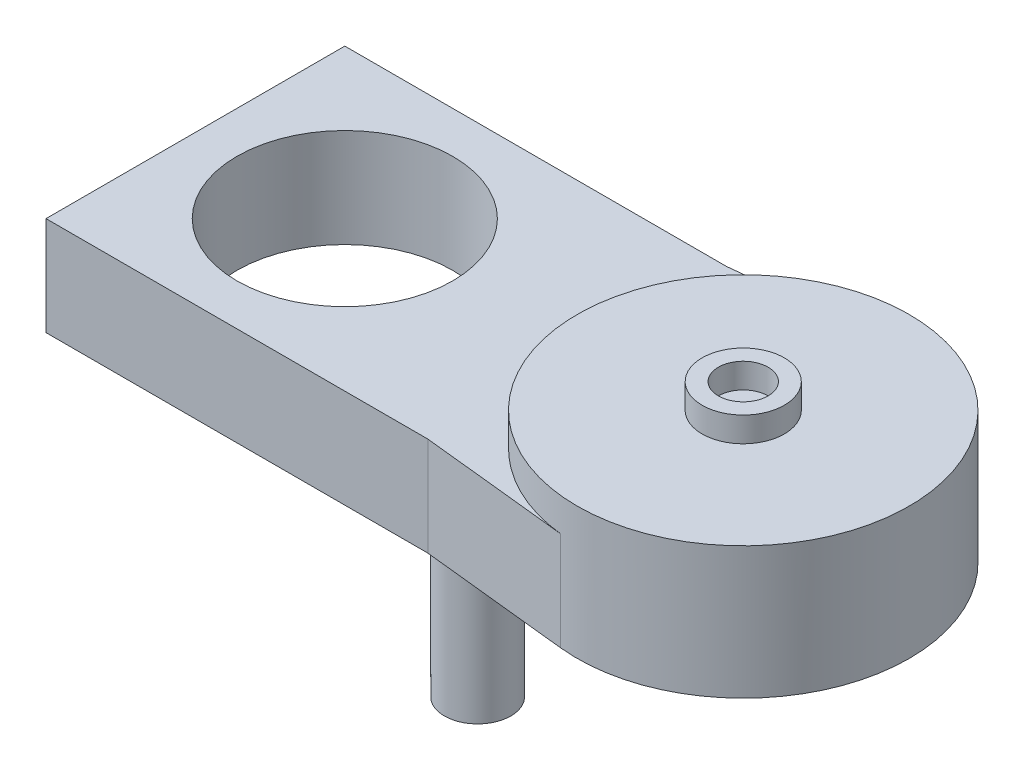
from build123d import *
from build123d.topology import SkipClean

# Parameters (mm, degrees)
SKETCH1_R           = 6.5
BOSS_EXTRUDE2_DEPTH = 5.95
SKETCH3_R           = 10
BOSS_EXTRUDE3_DEPTH = 2
SKETCH4_R           = 2
BOSS_EXTRUDE4_DEPTH = 10
SKETCH5_R           = 2.475
SKETCH5_R_2         = 1.5
BOSS_EXTRUDE5_DEPTH = 1.5


with BuildPart() as part:
    # Sketch1 → Boss-Extrude2 (new body)
    with BuildSketch(Plane(origin=(0, 0, 0), x_dir=(1, 0, 0), z_dir=(0, 1, 0))):
        with BuildLine():
            Line((14, 9), (22.950276243, 9.944751381))
            ThreePointArc((22.950276243, 9.944751381), (34, 0), (22.950276243, -9.944751381))
            Line((22.950276243, -9.944751381), (14, -9))
            Line((14, -9), (9, -9))
            Line((9, -9), (-9, -9))
            Line((-9, -9), (-9, 9))
            Line((-9, 9), (9, 9))
            Line((9, 9), (14, 9))
        make_face()
        Circle(SKETCH1_R, mode=Mode.SUBTRACT)
    extrude(amount=BOSS_EXTRUDE2_DEPTH)

    # Sketch3 → Boss-Extrude3 (add)
    with SkipClean():  # the faces are left unmerged after this step: merging them gives an invalid solid
        with BuildSketch(Plane(origin=(0, 5.95, 0), x_dir=(1, 0, 0), z_dir=(0, 1, 0))):
            with Locations((24, 0)):
                Circle(SKETCH3_R)
        extrude(amount=BOSS_EXTRUDE3_DEPTH)
    add(part.part.scale(1), mode=Mode.REPLACE)  # the faces are merged on a copy

    # Sketch4 → Boss-Extrude4 (add)
    with BuildSketch(Plane.XZ):
        with Locations((13, 5)):
            Circle(SKETCH4_R)
        with Locations((13, -5)):
            Circle(SKETCH4_R)
    extrude(amount=BOSS_EXTRUDE4_DEPTH)

    # Sketch5 → Boss-Extrude5 (add)
    with BuildSketch(Plane(origin=(0, 7.95, 0), x_dir=(1, 0, 0), z_dir=(0, 1, 0))):
        with Locations((24, 0)):
            Circle(SKETCH5_R)
        with Locations((24, 0)):
            Circle(SKETCH5_R_2, mode=Mode.SUBTRACT)
    extrude(amount=BOSS_EXTRUDE5_DEPTH)


solid = part.part
